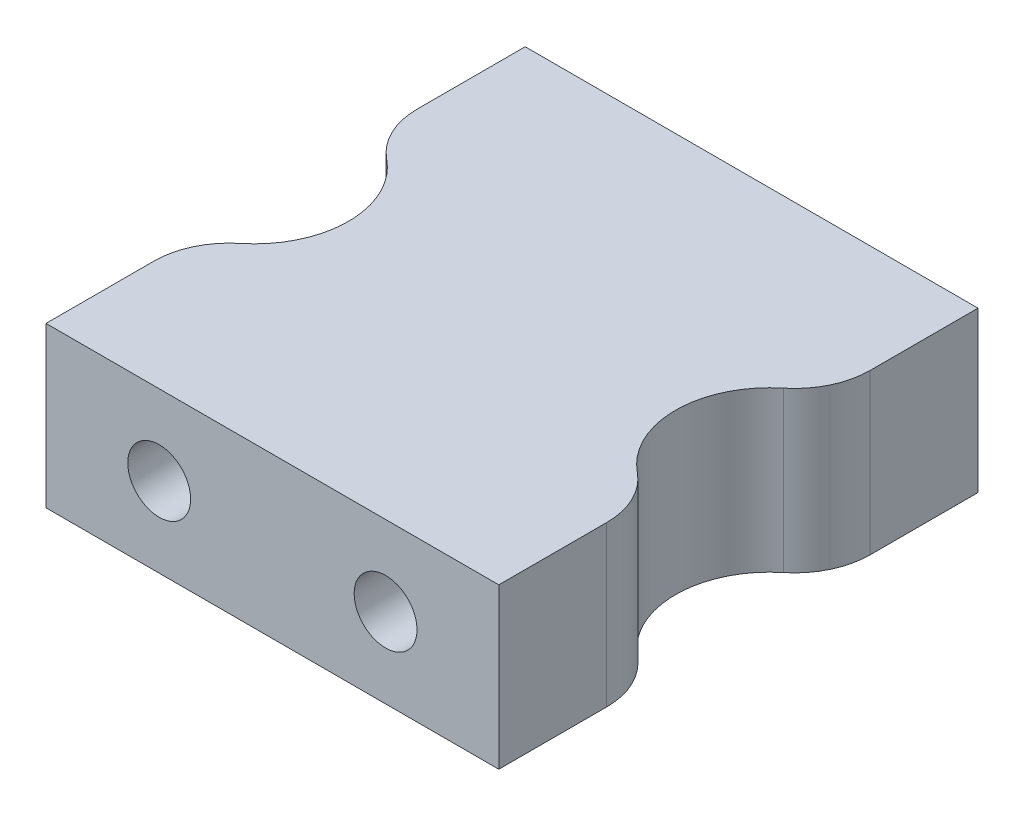
from build123d import *

# Parameters (mm, degrees)
SKETCH1_W           = 18
SKETCH1_H           = 6.35
BOSS_EXTRUDE1_DEPTH = 19.05
CUT_EXTRUDE1_DEPTH  = 27.967109597
SKETCH3_R           = 1.25
CUT_EXTRUDE2_DEPTH  = 5
FILLET2_R           = 3


with BuildPart() as part:
    # Sketch1 → Boss-Extrude1 (new body)
    with BuildSketch(Plane.XY):
        with Locations((9, 3.175)):
            Rectangle(SKETCH1_W, SKETCH1_H)
    extrude(amount=BOSS_EXTRUDE1_DEPTH)

    # Sketch2 → Cut-Extrude1 (cut, through all)
    with BuildSketch(Plane(origin=(0, 6.35, 0), x_dir=(1, 0, 0), z_dir=(0, 1, 0))):
        with BuildLine():
            Line((18, -6), (18, -13.05))
            ThreePointArc((18, -13.05), (15.5, -9.525), (18, -6))
        make_face()
        with BuildLine():
            Line((0, -6), (0, -13.05))
            ThreePointArc((0, -13.05), (2.5, -9.525), (0, -6))
        make_face()
    extrude(amount=-CUT_EXTRUDE1_DEPTH, mode=Mode.SUBTRACT)

    # Sketch3 → Cut-Extrude2 (cut)
    with BuildSketch(Plane(origin=(0, 0, 0), x_dir=(-1, 0, 0), z_dir=(0, 0, -1))):
        with Locations((-13.5, 3.175)):
            Circle(SKETCH3_R)
        with Locations((-4.5, 3.175)):
            Circle(SKETCH3_R)
    cut_extrude2 = extrude(amount=-CUT_EXTRUDE2_DEPTH, mode=Mode.SUBTRACT)

    # Mirror1: Cut-Extrude2 across plane
    add(cut_extrude2.mirror(Plane(origin=(0, 0, 9.525), x_dir=(1, 0, 0), z_dir=(0, 0, -1))), mode=Mode.SUBTRACT)

    # Fillet2
    fillet2_edges = [part.edges().sort_by_distance(p)[0] for p in [
        (18, 3.175, 13.05),
        (18, 3.175, 6),
        (0, 3.175, 13.05),
        (0, 3.175, 6),
    ]]
    fillet(fillet2_edges, radius=FILLET2_R)


solid = part.part
